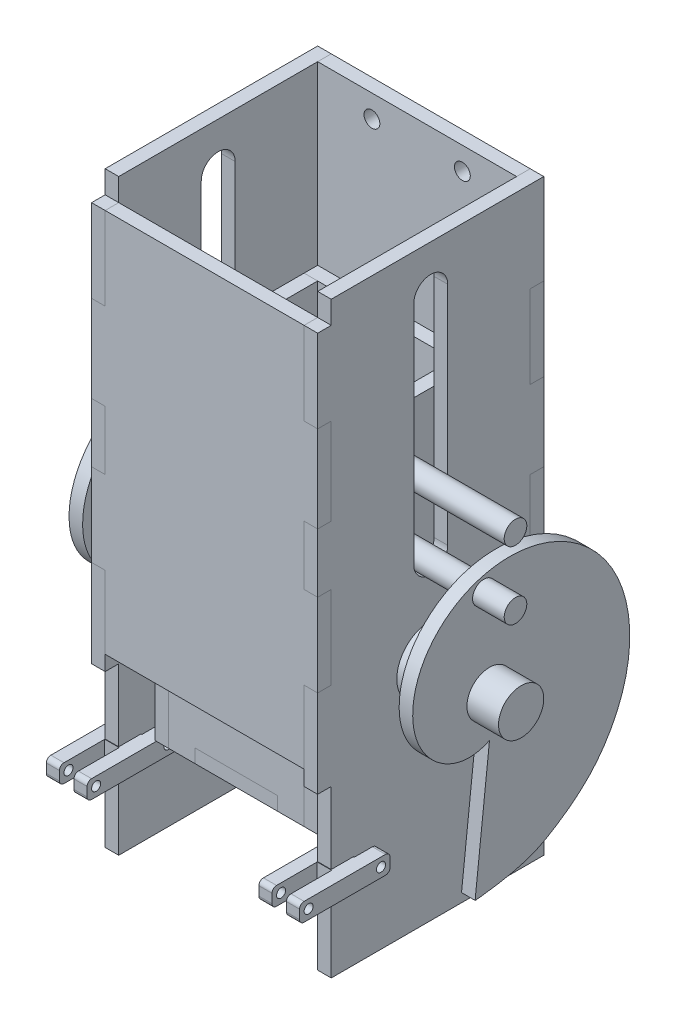
from build123d import *

# Parameters (mm, degrees)
BOSS_EXTRUDE1_DEPTH         = 3
BOSS_EXTRUDE3_DEPTH         = 3
BOSS_EXTRUDE5_DEPTH         = 3
BOSS_EXTRUDE10_DEPTH        = 3
BOSS_EXTRUDE11_DEPTH        = 3
SKETCH13_W                  = 3
SKETCH13_H                  = 18.346666667
CUT_EXTRUDE1_DEPTH          = 3
SKETCH15_R                  = 4.95
BOSS_EXTRUDE14_DEPTH        = 3
SKETCH14_R                  = 3.75
SKETCH14_W                  = 50
SKETCH14_H                  = 7.5
CUT_EXTRUDE2_DEPTH          = 79
BOSS_EXTRUDE15_DEPTH        = 20
BOSS_EXTRUDE15_DEPTH_BACK   = 70
SKETCH16_R                  = 2.5
BOSS_EXTRUDE15_2_DEPTH      = 20
BOSS_EXTRUDE15_2_DEPTH_BACK = 70
SKETCH17_R                  = 5
SKETCH17_W                  = 50
SKETCH17_H                  = 12
CUT_EXTRUDE3_DEPTH          = 54
CUT_EXTRUDE4_DEPTH          = 54
BOSS_EXTRUDE16_DEPTH        = 20
BOSS_EXTRUDE16_DEPTH_BACK   = 70
SKETCH24_R                  = 5
SKETCH24_R_2                = 4.75
CUT_EXTRUDE7_DEPTH          = 50
SKETCH18_R                  = 7.5
BOSS_EXTRUDE17_DEPTH        = 10
SKETCH19_R                  = 2.5
CUT_EXTRUDE5_DEPTH          = 71
SKETCH21_R                  = 7.5
SKETCH21_R_2                = 5
BOSS_EXTRUDE19_DEPTH        = 10
SKETCH20_W                  = 3
SKETCH20_H                  = 18.333333333
SKETCH20_H_2                = 18.33
BOSS_EXTRUDE18_DEPTH        = 3
SKETCH31_W                  = 3
SKETCH31_H                  = 0.1
SKETCH31_H_2                = 4
SKETCH31_W_2                = 3.2
CUT_EXTRUDE9_DEPTH          = 5
SKETCH31_5_W                = 3
SKETCH31_5_H                = 4
SKETCH31_5_W_2              = 0.1
BOSS_EXTRUDE26_DEPTH        = 5
BOSS_EXTRUDE29_DEPTH        = 10
BOSS_EXTRUDE29_DEPTH_BACK   = 10
SKETCH31_8_W                = 2.9
SKETCH31_8_H                = 4
SKETCH32_R                  = 1
CUT_EXTRUDE10_DEPTH         = 10
FILLET1_R                   = 1
SKETCH34_W                  = 5.835
SKETCH34_H                  = 3
BOSS_EXTRUDE31_DEPTH        = 3
SKETCH34_3_W                = 5.835
SKETCH34_3_H                = 3
BOSS_EXTRUDE32_DEPTH        = 3
BOSS_EXTRUDE33_DEPTH        = 3
BOSS_EXTRUDE34_DEPTH        = 3
SKETCH37_R                  = 1.75
CUT_EXTRUDE11_DEPTH         = 10
SKETCH38_W                  = 5.388069577
SKETCH38_H                  = 5
CUT_EXTRUDE12_DEPTH         = 5


with BuildPart() as part:
    # Sketch1 → Boss-Extrude1 (new body)
    with BuildSketch(Plane.YZ):
        Polygon((0.003333333, 18), (-11.663333333, 18), (-11.663333333, 15), (-23.333333333, 15), (-23.333333333, 18), (-35, 18), (-35, -18), (-23.333333333, -18), (-23.333333333, -15), (-11.663333333, -15), (-11.663333333, -18), (0.003333333, -18), (0.003333333, -15), (11.673333333, -15), (11.673333333, -18), (23.343333333, -18), (23.343333333, -15), (35, -15), (35, 15), (23.343333333, 15), (23.343333333, 18), (23.34, 18), (11.673333333, 18), (11.673333333, 15), (0.003333333, 15), align=None)
    extrude(amount=BOSS_EXTRUDE1_DEPTH)


with BuildPart() as part_1:
    # Body-Move/Copy1: moved
    add(part.part.moved(Location((15, 0, 0))))


with BuildPart() as body_2:
    # Sketch3 → Boss-Extrude3 (new body)
    with BuildSketch(Plane(origin=(0, 0, -15), x_dir=(1, 0, 0), z_dir=(0, 0, -1))):
        Polygon((15, 23.333333333), (15, 35), (-15, 35), (-15, 23.33), (-18, 23.33), (-18, 11.66), (-15, 11.66), (-15, -0.01), (-18, -0.01), (-18, -11.68), (-15, -11.68), (-15, -23.35), (-18, -23.35), (-18, -35), (18, -35), (18, -23.343333333), (15, -23.343333333), (15, -11.673333333), (18, -11.673333333), (18, -0.003333333), (15, -0.003333333), (15, 11.663333333), (18, 11.663333333), (18, 23.333333333), align=None)
    extrude(amount=BOSS_EXTRUDE3_DEPTH)


with BuildPart() as body_3:
    # Mirror1: mirrored copy
    add(part_1.part.mirror(Plane(origin=(0, 0, 0), x_dir=(0, 0, 1), z_dir=(1, 0, 0))))


with BuildPart() as body_4:
    # Mirror2: mirrored copy
    add(body_2.part.mirror(Plane.XY))


with BuildPart() as body_5:
    # Sketch5 → Boss-Extrude5 (new body)
    with BuildSketch(Plane.XZ.offset(35)):
        Polygon((-18, -9.165), (-15, -9.165), (-15, -15), (-9.165, -15), (-9.165, -18), (9.165, -18), (9.165, -15), (15, -15), (15, -9.165), (18, -9.165), (18, 9.165), (15, 9.165), (15, 15), (9.165, 15), (9.165, 18), (-9.165, 18), (-9.165, 15), (-15, 15), (-15, 9.165), (-18, 9.165), align=None)
    extrude(amount=BOSS_EXTRUDE5_DEPTH)


with BuildPart() as body_6:
    # Sketch10 → Boss-Extrude10 (new body)
    with BuildSketch(Plane.XY.offset(22)):
        Polygon((22, 37.5), (25, 37.5), (25, 56.67), (22, 56.67), (22, 75), (-22, 75), (-22, 56.67), (-25, 56.67), (-25, 37.5), (-22, 37.5), (-22, 24.423077661), (-25, 24.423077661), (-25, 6.089744328), (-22, 6.089744328), (-22, -55), (22, -55), (22, 6.089744328), (25, 6.089744328), (25, 24.423077661), (22, 24.423077661), align=None)
    extrude(amount=BOSS_EXTRUDE10_DEPTH)

    # Sketch13 → Cut-Extrude1 (cut)
    with BuildSketch(Plane.XY.offset(25)):
        Polygon((-22, -36.653333333), (-22, -55), (22, -55), (22, -36.653333333), (22, -13.32), (22, -10), (-22, -10), (-22, -13.32), align=None)
        with Locations((-23.5, -45.826666667)):
            Rectangle(SKETCH13_W, SKETCH13_H)
        with Locations((23.5, -45.826666667)):
            Rectangle(SKETCH13_W, SKETCH13_H)
    extrude(amount=-CUT_EXTRUDE1_DEPTH, mode=Mode.SUBTRACT)


with BuildPart() as body_7:
    # Sketch11 → Boss-Extrude11 (new body)
    with BuildSketch(Plane.YZ.offset(22)):
        Polygon((24.423077661, -25), (41.666666667, -25), (41.666666667, -22), (59.996666667, -22), (59.996666667, -25), (80, -25), (80, 22), (75, 22), (75, 25), (56.67, 25), (56.67, 22), (37.5, 22), (37.5, 25), (24.423077661, 25), (24.423077661, 22), (6.089744328, 22), (6.089744328, 25), (-13.32, 25), (-13.32, 22), (-50, 22), (-50, -25), (-31.653333333, -25), (-31.653333333, -22), (-13.32, -22), (-13.32, -25), (6.089744328, -25), (6.089744328, -22), (24.423077661, -22), align=None)
    extrude(amount=BOSS_EXTRUDE11_DEPTH)


with BuildPart() as body_8:
    # Mirror3: mirrored copy
    add(body_7.part.mirror(Plane(origin=(0, 0, 0), x_dir=(0, 0, 1), z_dir=(1, 0, 0))))


with BuildPart() as body_9:
    # Sketch15 → Boss-Extrude14 (new body)
    # profile 1 of 2: a face of its own
    with BuildSketch(Plane(origin=(-25, 0, 0), x_dir=(0, -1, 0), z_dir=(-1, 0, 0))):
        with BuildLine():
            Line((38.044741382, 3.183478212), (9, 0))
            add(Edge.make_bspline(
                [(9, 0), (12.019660327, 6.259467509), (6.142659861, 15.799084467), (-6.33620297, 17.673586478), (-15.08422068, 14.353217156), (-21.390639232, 7.525773733), (-24.362259203, -1.227378311), (-23.817499081, -10.422052284), (-20.707748579, -17.390734219), (-17.893719391, -20.918194982), (-16.877399159, -22)],
                knots=[0, 0, 0, 0, 0.114285714, 0.171428571, 0.228571429, 0.285714286, 0.342857143, 0.4, 0.457142857, 0.485287157, 0.485287157, 0.485287157, 0.485287157], degree=3))
            Line((-16.877399159, -22), (-6.089744328, -22))
            Line((-6.089744328, -22), (-6.089744328, -25))
            Line((-6.089744328, -25), (13.32, -25))
            Line((13.32, -25), (13.32, -22))
            Line((13.32, -22), (26.852036566, -22))
            add(Edge.make_bspline(
                [(26.852036566, -22), (27.140798816, -21.724244509), (29.583179765, -19.299172781), (33.520562761, -13.828372807), (36.935318584, -7.160318356), (38.135363247, 3.091438957), (38.050772101, 3.184139215)],
                knots=[0.792476637, 0.792476637, 0.792476637, 0.792476637, 0.8, 0.857142857, 0.914285714, 0.971428571, 0.971428571, 0.971428571, 0.971428571], degree=3))
            Line((38.050772101, 3.184139215), (38.044741382, 3.183478212))
        make_face()
        with Locations(Location((0, 0, 0), (0, 0, 90))):
            Circle(SKETCH15_R, mode=Mode.SUBTRACT)
    # profile 2 of 2: a face of its own
    with BuildSketch(Plane(origin=(-25, 0, 0), x_dir=(0, -1, 0), z_dir=(-1, 0, 0))):
        with BuildLine():
            Line((-6.089744328, -22), (-16.877399159, -22))
            add(Edge.make_bspline(
                [(-16.877399159, -22), (-15.830230827, -23.114640761), (-12.44298427, -26.166381218), (-5.698257282, -29.769099046), (3.281696943, -31.443568181), (12.351906091, -30.469354485), (20.41811925, -27.134683659), (24.947537757, -23.818714194), (26.852036566, -22)],
                knots=[0.485287157, 0.485287157, 0.485287157, 0.485287157, 0.514285714, 0.571428571, 0.628571429, 0.685714286, 0.742857143, 0.792476637, 0.792476637, 0.792476637, 0.792476637], degree=3))
            Line((26.852036566, -22), (13.32, -22))
            Line((13.32, -22), (13.32, -25))
            Line((13.32, -25), (-6.089744328, -25))
            Line((-6.089744328, -25), (-6.089744328, -22))
        make_face()
    extrude(amount=BOSS_EXTRUDE14_DEPTH)


with BuildPart() as cut_extrude2_tool:
    # Sketch14 → Cut-Extrude2 (new body)
    with BuildSketch(Plane(origin=(-25, 0, 0), x_dir=(0, -1, 0), z_dir=(-1, 0, 0))):
        with Locations((-70, 0)):
            Circle(SKETCH14_R)
        with Locations((-20, 0)):
            Circle(SKETCH14_R)
        with Locations((-45, 0)):
            Rectangle(SKETCH14_W, SKETCH14_H)
    extrude(amount=-CUT_EXTRUDE2_DEPTH)


with BuildPart() as body_8_1:
    add(body_8.part)

    # Cut-Extrude2: cut by cut_extrude2_tool
    add(cut_extrude2_tool.part, mode=Mode.SUBTRACT)


with BuildPart() as body_7_1:
    add(body_7.part)

    # Cut-Extrude2: cut by cut_extrude2_tool
    add(cut_extrude2_tool.part, mode=Mode.SUBTRACT)


with BuildPart() as body_9_1:
    # Body-Move/Copy5: moved
    add(body_9.part.moved(Location((-10, 0, 0))))


with BuildPart() as body_10:
    # Sketch16 → Boss-Extrude15 (new, two sides: drawn at the far end of the back side and taken through both)
    with BuildSketch(Plane(origin=(-25, 0, 0), x_dir=(0, -1, 0), z_dir=(-1, 0, 0)).offset(-BOSS_EXTRUDE15_DEPTH_BACK)):
        with Locations(Location((-35, 1.25, 0), (0, 0, 90))):
            Circle(SKETCH16_R)
    extrude(amount=BOSS_EXTRUDE15_DEPTH + BOSS_EXTRUDE15_DEPTH_BACK)


with BuildPart() as body_11:
    # Sketch16 → Boss-Extrude15 2 (new, two sides: drawn at the far end of the back side and taken through both)
    with BuildSketch(Plane(origin=(-25, 0, 0), x_dir=(0, -1, 0), z_dir=(-1, 0, 0)).offset(-BOSS_EXTRUDE15_2_DEPTH_BACK)):
        with Locations(Location((-20, 1.25, 0), (0, 0, 90))):
            Circle(SKETCH16_R)
    extrude(amount=BOSS_EXTRUDE15_2_DEPTH + BOSS_EXTRUDE15_2_DEPTH_BACK)


with BuildPart() as body_4_1:
    # Body-Move/Copy2: moved
    add(body_4.part.moved(Location((0, 10, 0))))

    # Sketch34 → Boss-Extrude31 (add)
    with BuildSketch(Plane.XZ.offset(25)):
        with Locations((-12.0825, 16.5)):
            Rectangle(SKETCH34_W, SKETCH34_H)
        with Locations((12.0825, 16.5)):
            Rectangle(SKETCH34_W, SKETCH34_H)
    extrude(amount=BOSS_EXTRUDE31_DEPTH)


with BuildPart() as part_2:
    # Body-Move/Copy2: moved
    add(part_1.part.moved(Location((0, 10, 0))))


with BuildPart() as body_2_1:
    # Body-Move/Copy2: moved
    add(body_2.part.moved(Location((0, 10, 0))))

    # Sketch34<3> → Boss-Extrude32 (add)
    with BuildSketch(Plane.XZ.offset(25)):
        with Locations((-12.0825, -16.5)):
            Rectangle(SKETCH34_3_W, SKETCH34_3_H)
        with Locations((12.0825, -16.5)):
            Rectangle(SKETCH34_3_W, SKETCH34_3_H)
    extrude(amount=BOSS_EXTRUDE32_DEPTH)


with BuildPart() as body_5_1:
    # Body-Move/Copy2: moved
    add(body_5.part.moved(Location((0, 10, 0))))


with BuildPart() as body_3_1:
    # Body-Move/Copy2: moved
    add(body_3.part.moved(Location((0, 10, 0))))


with BuildPart() as cut_extrude3_tool:
    # Sketch17 → Cut-Extrude3 (new body)
    with BuildSketch(Plane(origin=(-25, 0, 0), x_dir=(0, -1, 0), z_dir=(-1, 0, 0))):
        Circle(SKETCH17_R)
        with Locations((25, 0)):
            Rectangle(SKETCH17_W, SKETCH17_H)
    extrude(amount=-CUT_EXTRUDE3_DEPTH)


with BuildPart() as body_3_2:
    add(body_3_1.part)

    # Cut-Extrude3: cut by cut_extrude3_tool
    add(cut_extrude3_tool.part, mode=Mode.SUBTRACT)


with BuildPart() as body_5_2:
    add(body_5_1.part)

    # Cut-Extrude3: cut by cut_extrude3_tool
    add(cut_extrude3_tool.part, mode=Mode.SUBTRACT)


with BuildPart() as part_3:
    add(part_2.part)

    # Cut-Extrude3: cut by cut_extrude3_tool
    add(cut_extrude3_tool.part, mode=Mode.SUBTRACT)


with BuildPart() as cut_extrude4_tool:
    # Sketch17<4> → Cut-Extrude4 (new body)
    with BuildSketch(Plane(origin=(-25, 0, 0), x_dir=(0, -1, 0), z_dir=(-1, 0, 0))):
        with BuildLine():
            ThreePointArc((5, 0), (3.535533906, 3.535533906), (0, 5))
            Line((0, 5), (0, -5))
            ThreePointArc((0, -5), (3.535533906, -3.535533906), (5, 0))
        make_face()
        with BuildLine():
            Line((0, -5), (0, 5))
            ThreePointArc((0, 5), (-5, 0), (0, -5))
        make_face()
    extrude(amount=-CUT_EXTRUDE4_DEPTH)


with BuildPart() as body_7_2:
    add(body_7_1.part)

    # Cut-Extrude4: cut by cut_extrude4_tool
    add(cut_extrude4_tool.part, mode=Mode.SUBTRACT)


with BuildPart() as body_8_2:
    add(body_8_1.part)

    # Cut-Extrude4: cut by cut_extrude4_tool
    add(cut_extrude4_tool.part, mode=Mode.SUBTRACT)


with BuildPart() as body_12:
    # Sketch17<5> → Boss-Extrude16 (new, two sides: drawn at the far end of the back side and taken through both)
    with BuildSketch(Plane(origin=(-25, 0, 0), x_dir=(0, -1, 0), z_dir=(-1, 0, 0)).offset(-BOSS_EXTRUDE16_DEPTH_BACK)):
        with BuildLine():
            ThreePointArc((5, 0), (3.535533906, 3.535533906), (0, 5))
            Line((0, 5), (0, -5))
            ThreePointArc((0, -5), (3.535533906, -3.535533906), (5, 0))
        make_face()
        with BuildLine():
            Line((0, -5), (0, 5))
            ThreePointArc((0, 5), (-5, 0), (0, -5))
        make_face()
    extrude(amount=BOSS_EXTRUDE16_DEPTH + BOSS_EXTRUDE16_DEPTH_BACK)

    # Sketch24 → Cut-Extrude7 (cut)
    with BuildSketch(Plane(origin=(-25, 0, 0), x_dir=(0, -1, 0), z_dir=(-1, 0, 0))):
        with Locations(Location((0, 0, 0), (0, 0, 90))):
            Circle(SKETCH24_R)
        with Locations(Location((0, 0, 0), (0, 0, 90))):
            Circle(SKETCH24_R_2, mode=Mode.SUBTRACT)
    extrude(amount=-CUT_EXTRUDE7_DEPTH, mode=Mode.SUBTRACT)

    # Sketch18 → Boss-Extrude17 (add)
    with BuildSketch(Plane(origin=(-25, 0, 0), x_dir=(0, -1, 0), z_dir=(-1, 0, 0))):
        with Locations(Location((0, 0, 0), (0, 0, 90))):
            Circle(SKETCH18_R)
    extrude(amount=BOSS_EXTRUDE17_DEPTH)

    # Sketch21 → Boss-Extrude19 (add)
    with BuildSketch(Plane.YZ.offset(25)):
        with Locations(Location((0, 0, 0), (0, 0, 90))):
            Circle(SKETCH21_R)
        with Locations(Location((0, 0, 0), (0, 0, 90))):
            Circle(SKETCH21_R_2, mode=Mode.SUBTRACT)
    extrude(amount=BOSS_EXTRUDE19_DEPTH)


with BuildPart() as cut_extrude5_tool:
    # Sketch19 → Cut-Extrude5 (new body)
    with BuildSketch(Plane(origin=(-18, 0, 0), x_dir=(0, -1, 0), z_dir=(-1, 0, 0))):
        with Locations(Location((-20, 1.25, 0), (0, 0, 90))):
            Circle(SKETCH19_R)
        with Locations(Location((-35, 1.25, 0), (0, 0, 90))):
            Circle(SKETCH19_R)
    extrude(amount=-CUT_EXTRUDE5_DEPTH)


with BuildPart() as part_4:
    add(part_3.part)

    # Cut-Extrude5: cut by cut_extrude5_tool
    add(cut_extrude5_tool.part, mode=Mode.SUBTRACT)

    # Sketch35 → Boss-Extrude33 (add)
    with BuildSketch(Plane.XZ.offset(25)):
        Polygon((18, 18), (15, 18), (15, 15), (15, 9.165), (18, 9.165), align=None)
        Polygon((18, -18), (18, -9.165), (15, -9.165), (15, -15), (15, -18), align=None)
    extrude(amount=BOSS_EXTRUDE33_DEPTH)


with BuildPart() as body_3_3:
    add(body_3_2.part)

    # Cut-Extrude5: cut by cut_extrude5_tool
    add(cut_extrude5_tool.part, mode=Mode.SUBTRACT)

    # Sketch36 → Boss-Extrude34 (add)
    with BuildSketch(Plane.XZ.offset(25)):
        Polygon((-18, 18), (-18, 9.165), (-15, 9.165), (-15, 15), (-15, 18), align=None)
        Polygon((-15, -15), (-15, -9.165), (-18, -9.165), (-18, -18), (-15, -18), align=None)
    extrude(amount=BOSS_EXTRUDE34_DEPTH)


with BuildPart() as body_13:
    # Sketch20 → Boss-Extrude18 (new body)
    with BuildSketch(Plane(origin=(0, 0, -25), x_dir=(1, 0, 0), z_dir=(0, 0, -1))):
        Polygon((22, 50), (-22, 50), (-22, 31.653333333), (-22, 13.32), (-22, -6.089744328), (-22, -24.423077661), (-22, -41.666666667), (-22, -59.996666667), (-22, -80), (22, -80), (22, -59.996666667), (22, -41.666666667), (22, -24.423077661), (22, -6.089744328), (22, 13.32), (22, 31.653333333), align=None)
        with Locations((-23.5, 22.486666666)):
            Rectangle(SKETCH20_W, SKETCH20_H)
        with Locations((-23.5, -15.256410995)):
            Rectangle(SKETCH20_W, SKETCH20_H)
        with Locations((-23.5, -50.831666667)):
            Rectangle(SKETCH20_W, SKETCH20_H_2)
        with Locations((23.5, -50.831666667)):
            Rectangle(SKETCH20_W, SKETCH20_H_2)
        with Locations((23.5, -15.256410995)):
            Rectangle(SKETCH20_W, SKETCH20_H)
        with Locations((23.5, 22.486666666)):
            Rectangle(SKETCH20_W, SKETCH20_H)
    extrude(amount=-BOSS_EXTRUDE18_DEPTH)

    # Sketch37 → Cut-Extrude11 (cut)
    with BuildSketch(Plane(origin=(0, 0, -25), x_dir=(1, 0, 0), z_dir=(0, 0, -1))):
        with Locations(Location((-10, 44.18, 0), (0, 0, 180))):
            Circle(SKETCH37_R)
        with Locations(Location((10, 44.18, 0), (0, 0, 180))):
            Circle(SKETCH37_R)
        with Locations(Location((-10, -75, 0), (0, 0, 180))):
            Circle(SKETCH37_R)
        with Locations(Location((10, -75, 0), (0, 0, 180))):
            Circle(SKETCH37_R)
    extrude(amount=-CUT_EXTRUDE11_DEPTH, mode=Mode.SUBTRACT)


with BuildPart() as body_14:
    # Mirror5: mirrored copy
    add(body_9_1.part.mirror(Plane(origin=(0, 0, 0), x_dir=(0, 0, 1), z_dir=(1, 0, 0))))


with BuildPart() as cut_extrude9_tool:
    # Sketch31 → Cut-Extrude9 (new body)
    with BuildSketch(Plane.XY.offset(22)):
        with Locations((-23.5, -29.27)):
            Rectangle(SKETCH31_W, SKETCH31_H)
        with Locations((-23.5, -31.32)):
            Rectangle(SKETCH31_W, SKETCH31_H_2)
        with Locations((-23.5, -33.37)):
            Rectangle(SKETCH31_W, SKETCH31_H)
        with Locations((23.5, -31.32)):
            Rectangle(SKETCH31_W_2, SKETCH31_H_2)
        Polygon((19, -29.32), (21.9, -29.32), (25.1, -29.32), (28, -29.32), (28, -29.22), (19, -29.22), align=None)
    extrude(amount=-CUT_EXTRUDE9_DEPTH)


with BuildPart() as body_7_3:
    add(body_7_2.part)

    # Cut-Extrude9: cut by cut_extrude9_tool
    add(cut_extrude9_tool.part, mode=Mode.SUBTRACT)


with BuildPart() as body_8_3:
    add(body_8_2.part)

    # Cut-Extrude9: cut by cut_extrude9_tool
    add(cut_extrude9_tool.part, mode=Mode.SUBTRACT)


with BuildPart() as body_15:
    # Sketch31<5> → Boss-Extrude26 (new body)
    with BuildSketch(Plane.XY.offset(22)):
        with Locations((-23.5, -31.32)):
            Rectangle(SKETCH31_5_W, SKETCH31_5_H)
        with Locations((-21.95, -31.32)):
            Rectangle(SKETCH31_5_W_2, SKETCH31_5_H)
        with Locations((-25.05, -31.32)):
            Rectangle(SKETCH31_5_W_2, SKETCH31_5_H)
    extrude(amount=-BOSS_EXTRUDE26_DEPTH)

    # Sketch31<8> → Boss-Extrude29 (add, two sides: drawn at the far end of the back side and taken through both)
    with BuildSketch(Plane.XY.offset(22).offset(-BOSS_EXTRUDE29_DEPTH_BACK)):
        with Locations((-26.55, -31.32)):
            Rectangle(SKETCH31_8_W, SKETCH31_8_H)
        with Locations((-20.45, -31.32)):
            Rectangle(SKETCH31_8_W, SKETCH31_8_H)
    extrude(amount=BOSS_EXTRUDE29_DEPTH + BOSS_EXTRUDE29_DEPTH_BACK)

    # Sketch32 → Cut-Extrude10 (cut)
    with BuildSketch(Plane(origin=(-28, 0, 0), x_dir=(0, -1, 0), z_dir=(-1, 0, 0))):
        with Locations(Location((31.252782598, 30, 0), (0, 0, 270))):
            Circle(SKETCH32_R)
        with Locations(Location((31.252782598, 14, 0), (0, 0, 270))):
            Circle(SKETCH32_R)
    extrude(amount=-CUT_EXTRUDE10_DEPTH, mode=Mode.SUBTRACT)

    # Fillet1
    fillet1_edges = [body_15.edges().sort_by_distance(p)[0] for p in [
        (-26.55, -33.32, 12),
        (-26.55, -29.32, 32),
        (-26.55, -29.32, 12),
        (-26.55, -33.32, 32),
        (-20.45, -29.32, 32),
        (-20.45, -33.32, 12),
        (-20.45, -33.32, 32),
        (-20.45, -29.32, 12),
    ]]
    fillet(fillet1_edges, radius=FILLET1_R)


with BuildPart() as body_16:
    # Mirror6: mirrored copy
    add(body_15.part.mirror(Plane(origin=(0, 0, 0), x_dir=(0, 0, 1), z_dir=(1, 0, 0))))


with BuildPart() as body_15_1:
    add(body_15.part)

    # Sketch38 → Cut-Extrude12 (cut)
    with BuildSketch(Plane(origin=(-28, 0, 0), x_dir=(0, -1, 0), z_dir=(-1, 0, 0))):
        with Locations((30.625965212, 14.5)):
            Rectangle(SKETCH38_W, SKETCH38_H)
    extrude(amount=-CUT_EXTRUDE12_DEPTH, mode=Mode.SUBTRACT)


solid = Compound([body_6.part, body_9_1.part, body_10.part, body_11.part, body_4_1.part, body_2_1.part, body_5_2.part, body_12.part, part_4.part, body_3_3.part, body_13.part, body_14.part, body_7_3.part, body_8_3.part, body_16.part, body_15_1.part])
